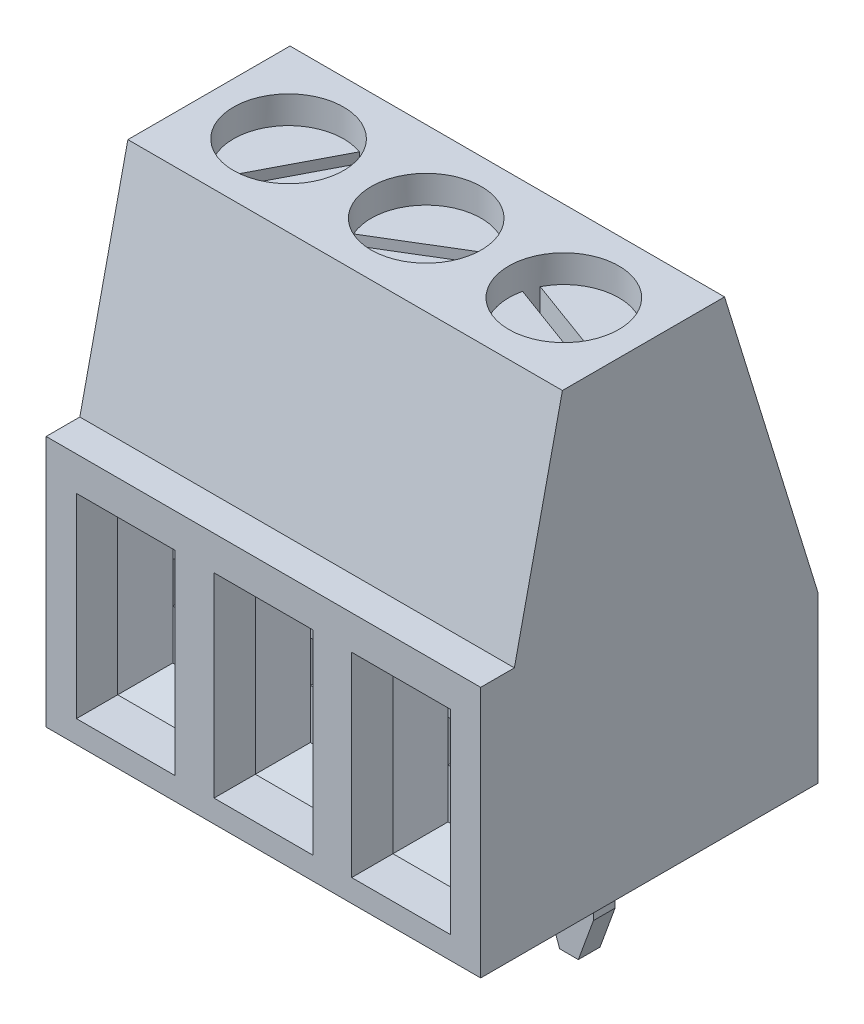
from build123d import *
from OCP.BRepFilletAPI import BRepFilletAPI_MakeChamfer
from build123d.topology import SkipClean

# Parameters (mm, degrees)
SKETCH1_W             = 8.02
SKETCH1_H             = 6.223
EXTRUDE1_DEPTH        = 8.636
CUT_EXTRUDE1_DEPTH    = 14.327663899
CUT_EXTRUDE2_DEPTH    = 14.327663899
SKETCH4_R             = 1.016
CUT_EXTRUDE3_DEPTH    = 0.508
SKETCH6_W             = 1.82195597
SKETCH6_H             = 3.601033201
CUT_EXTRUDE5_DEPTH    = 1.27
CHAMFER1_SIZE         = 0.508
CUT_EXTRUDE6_DEPTH    = 1.27
SKETCH8_W             = 0.9
SKETCH8_H             = 0.4
EXTRUDE2_DEPTH        = 1.905
CHAMFER2_SIZE         = 0.762
CHAMFER2_SIZE2        = 0.277345319
LPATTERN1_START       = 0.41494466
LPATTERN1_DEPTH       = 3.601033201
LPATTERN1_START_2     = 8.128
LPATTERN1_2_OUTLINE_R = 1.016
LPATTERN1_2_DEPTH     = 0.508
LPATTERN1_START_3     = 1.83446126
LPATTERN1_3_DEPTH     = 0.762
LPATTERN1_START_4     = -1.143
LPATTERN1_4_OUTLINE_W = 0.9
LPATTERN1_4_OUTLINE_H = 0.4
LPATTERN1_4_DEPTH     = 1.55794466
LPATTERN1_START_5     = -3.5
LPATTERN1_5_DEPTH     = 0.4
LPATTERN1_6_DEPTH     = 8
CUT_EXTRUDE4_START    = -0.508
CUT_EXTRUDE4_DEPTH    = 0.508


with BuildPart() as part:
    # Sketch1 → Extrude1 (new body)
    with BuildSketch(Plane(origin=(0, 0, 0), x_dir=(1, 0, 0), z_dir=(0, 1, 0))):
        with Locations((4.01, 3.1115)):
            Rectangle(SKETCH1_W, SKETCH1_H)
    extrude(amount=EXTRUDE1_DEPTH)

    # Sketch2 → Cut-Extrude1 (cut, through all)
    with BuildSketch(Plane(origin=(8.02, 0, 0), x_dir=(0, 0, -1), z_dir=(1, 0, 0))):
        Polygon((0, 4.645946632), (0.62179162, 4.645946632), (1.508470146, 8.636), (0, 8.636), align=None)
    extrude(amount=-CUT_EXTRUDE1_DEPTH, mode=Mode.SUBTRACT)

    # Sketch3 → Cut-Extrude2 (cut, through all)
    with BuildSketch(Plane(origin=(8.02, 0, 0), x_dir=(0, 0, -1), z_dir=(1, 0, 0))):
        Polygon((4.500853694, 8.636), (6.223, 3.053870593), (6.223, 8.636), align=None)
    extrude(amount=-CUT_EXTRUDE2_DEPTH, mode=Mode.SUBTRACT)

    # Sketch4 → Cut-Extrude3 (cut)
    with BuildSketch(Plane(origin=(0, 8.636, 0), x_dir=(1, 0, 0), z_dir=(0, 1, 0))):
        with Locations(Location((4.01, 3.00466192, 0), (0, 0, 270))):
            Circle(SKETCH4_R)
    extrude(amount=-CUT_EXTRUDE3_DEPTH, mode=Mode.SUBTRACT)

    # Sketch6 → Cut-Extrude5 (cut)
    with BuildSketch(Plane.XY):
        with Locations((4.01, 2.215461261)):
            Rectangle(SKETCH6_W, SKETCH6_H)
    extrude(amount=-CUT_EXTRUDE5_DEPTH, mode=Mode.SUBTRACT)

    # Chamfer1
    chamfer1_edges = [part.edges().sort_by_distance(p)[0] for p in [
        (4.01, 4.015977861, -1.27),
        (4.920977985, 2.21546126, -1.27),
        (4.01, 0.41494466, -1.27),
        (3.099022015, 2.21546126, -1.27),
    ]]
    chamfer(chamfer1_edges, length=CHAMFER1_SIZE)

    # Sketch7 → Cut-Extrude6 (cut)
    with BuildSketch(Plane.XY.offset(-1.27)):
        Polygon((3.607022015, 2.59646126), (3.607021944, 1.83446126), (4.412977985, 1.83446126), (4.412977985, 2.59646126), align=None)
    extrude(amount=-CUT_EXTRUDE6_DEPTH, mode=Mode.SUBTRACT)

    # Sketch8 → Extrude2 (add)
    with BuildSketch(Plane.XZ):
        with Locations((4.01, -3.3)):
            Rectangle(SKETCH8_W, SKETCH8_H)
    extrude(amount=EXTRUDE2_DEPTH)

    # Chamfer2: one chamfer whose edges measure the first distance from different faces: ONE call of the kernel's chamfer builder (chamfer() names one face for all edges)
    chamfer2_edges_1 = [part.edges().sort_by_distance(p)[0] for p in [
        (3.56, -1.905, -3.3),
    ]]
    chamfer2_side_1 = [part.faces().sort_by_distance(p)[0] for p in [
        (3.56, -0.9525, -3.3),
    ]]
    chamfer2_edges_2 = [part.edges().sort_by_distance(p)[0] for p in [
        (4.46, -1.905, -3.3),
    ]]
    chamfer2_side_2 = [part.faces().sort_by_distance(p)[0] for p in [
        (4.46, -0.9525, -3.3),
    ]]
    chamfer2 = BRepFilletAPI_MakeChamfer(part.part.solid().wrapped)
    for e in chamfer2_edges_1:
        chamfer2.Add(CHAMFER2_SIZE, CHAMFER2_SIZE2, e.wrapped, chamfer2_side_1[0].wrapped)  # the first distance lies on this face
    for e in chamfer2_edges_2:
        chamfer2.Add(CHAMFER2_SIZE, CHAMFER2_SIZE2, e.wrapped, chamfer2_side_2[0].wrapped)  # the first distance lies on this face
    add(Compound.cast(chamfer2.Shape()), mode=Mode.REPLACE)

    # LPattern1: read off the stored shape, not the designer's step
    # LPattern1 outline → LPattern1 (cut)
    with BuildSketch(Plane(origin=(0, 0, 0), x_dir=(1, 0, 0), z_dir=(0, 1, 0)).offset(LPATTERN1_START)):
        Polygon((7.460977985, 0.762), (6.952977985, 1.27), (6.147022015, 1.27), (5.639022015, 0.762), (5.639022015, 0), (7.460977985, 0), align=None)
        Polygon((0.559022015, 0), (2.380977985, 0), (2.380977985, 0.762), (1.872977985, 1.27), (1.067022015, 1.27), (0.559022015, 0.762), align=None)
    extrude(amount=LPATTERN1_DEPTH, mode=Mode.SUBTRACT)

    # LPattern1 2 outline → LPattern1 2 (cut)
    with BuildSketch(Plane(origin=(0, 0, 0), x_dir=(1, 0, 0), z_dir=(0, 1, 0)).offset(LPATTERN1_START_2)):
        with Locations((6.55, 3.00466192)):
            Circle(LPATTERN1_2_OUTLINE_R)
        with Locations((1.47, 3.00466192)):
            Circle(LPATTERN1_2_OUTLINE_R)
    extrude(amount=LPATTERN1_2_DEPTH, mode=Mode.SUBTRACT)

    # LPattern1 3 outline → LPattern1 3 (cut)
    with BuildSketch(Plane(origin=(0, 0, 0), x_dir=(1, 0, 0), z_dir=(0, 1, 0)).offset(LPATTERN1_START_3)):
        Polygon((6.147022015, 1.27), (6.952977985, 1.27), (6.952977985, 2.54), (6.147021944, 2.54), align=None)
        Polygon((1.067022015, 1.27), (1.872977985, 1.27), (1.872977985, 2.54), (1.067021944, 2.54), align=None)
    extrude(amount=LPATTERN1_3_DEPTH, mode=Mode.SUBTRACT)

    # LPattern1 4 outline → LPattern1 4 (add)
    with BuildSketch(Plane(origin=(0, 0, 0), x_dir=(1, 0, 0), z_dir=(0, 1, 0)).offset(LPATTERN1_START_4)):
        with Locations((1.47, 3.3)):
            Rectangle(LPATTERN1_4_OUTLINE_W, LPATTERN1_4_OUTLINE_H)
        with Locations((6.55, 3.3)):
            Rectangle(LPATTERN1_4_OUTLINE_W, LPATTERN1_4_OUTLINE_H)
    extrude(amount=LPATTERN1_4_DEPTH)

    # LPattern1 5 outline → LPattern1 5 (add)
    with BuildSketch(Plane.XY.offset(LPATTERN1_START_5)):
        Polygon((1.297345319, -1.905), (1.642654681, -1.905), (1.92, -1.143), (1.02, -1.143), align=None)
        Polygon((6.377345319, -1.905), (6.722654681, -1.905), (7, -1.143), (6.1, -1.143), align=None)
    extrude(amount=LPATTERN1_5_DEPTH)

    # LPattern1 6 outline → LPattern1 6 (add)
    with BuildSketch(Plane.YZ):
        Polygon((0.41494466, -1.27), (0.92294466, -1.27), (0.41494466, -0.762), align=None)
        Polygon((4.015977861, -1.27), (4.015977861, -0.762), (3.507977861, -1.27), align=None)
    extrude(amount=LPATTERN1_6_DEPTH)

    # Sketch5 → Cut-Extrude4 (cut)
    with SkipClean():  # the faces are left unmerged after this step: merging them gives an invalid solid
        with BuildSketch(Plane(origin=(0, 8.128, 0), x_dir=(1, 0, 0), z_dir=(0, 1, 0)).offset(CUT_EXTRUDE4_START)):
            with BuildLine():
                ThreePointArc((5.647513235, 3.471324151), (5.596258893, 3.354853153), (5.559965426, 3.232888875))
                Line((5.559965426, 3.232888875), (7.452486765, 2.537999689))
                ThreePointArc((7.452486765, 2.537999689), (7.503741107, 2.654470687), (7.540034574, 2.776434965))
                Line((7.540034574, 2.776434965), (5.647513235, 3.471324151))
            make_face()
            with BuildLine():
                ThreePointArc((3.08182296, 2.591450857), (3.140754275, 2.478669649), (3.213321028, 2.374139426))
                Line((3.213321028, 2.374139426), (4.93817704, 3.417872983))
                ThreePointArc((4.93817704, 3.417872983), (4.879245725, 3.530654191), (4.806678972, 3.635184414))
                Line((4.806678972, 3.635184414), (3.08182296, 2.591450857))
            make_face()
            with BuildLine():
                ThreePointArc((0.891932879, 2.169141481), (1.000906863, 2.103436294), (1.117239285, 2.051868197))
                Line((1.117239285, 2.051868197), (2.048067121, 3.840182359))
                ThreePointArc((2.048067121, 3.840182359), (1.939093137, 3.905887546), (1.822760715, 3.957455643))
                Line((1.822760715, 3.957455643), (0.891932879, 2.169141481))
            make_face()
        extrude(amount=CUT_EXTRUDE4_DEPTH, mode=Mode.SUBTRACT)


solid = part.part
